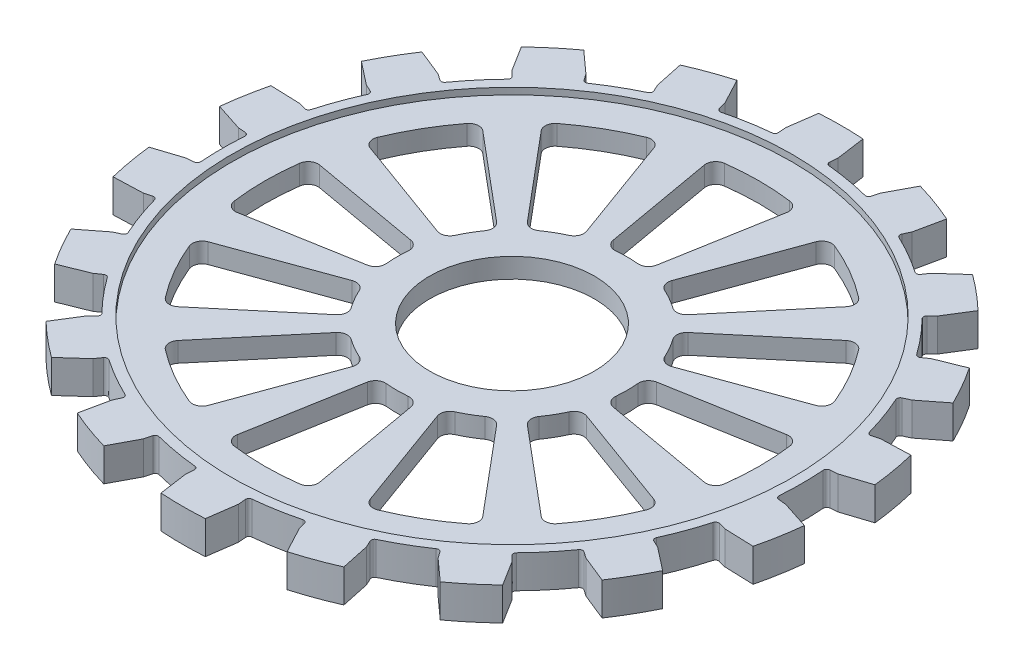
from build123d import *

# Parameters (mm, degrees)
SKETCH_2_W                       = 25
SKETCH_2_H                       = 6
SKETCH_3_W                       = 40
SKETCH_3_H                       = 6
CUT_REVOLVE_2_ANGLE              = 20
FILLET_1_R                       = 3
PATTERN_CIRCULAR_1_COUNT         = 12
FILLET_1_OF_PATTERN_CIRCULAR_1_R = 3
SKETCH_4_W                       = 12
SKETCH_4_H                       = 10
CUT_REVOLVE_3_ANGLE              = 10
FILLET_2_R                       = 1
CHAMFER_1_SIZE                   = 8.662951749
CHAMFER_2_SIZE                   = 8.662951749
PATTERN_START                    = -5
PATTERN_CIRCULAR_2_DEPTH         = 10


with BuildPart() as part:
    # Эскиз1 → Повернуть1 (revolve)
    with BuildSketch(Plane.XY, mode=Mode.PRIVATE) as revolve_1_sk:
        Polygon((0, 3), (85, 3), (85, 5), (100, 5), (100, -5), (85, -5), (85, -3), (0, -3), align=None)
    revolve(revolve_1_sk.sketch.rotate(Axis((0, 0, 0), (0, 1, 0)), 90), axis=Axis((0, 0, 0), (0, 1, 0)))

    # Эскиз2 → Вырез-Повернуть1 (revolve, cut)
    with BuildSketch(Plane.XY, mode=Mode.PRIVATE) as cut_revolve_1_sk:
        with Locations((12.5, 0)):
            Rectangle(SKETCH_2_W, SKETCH_2_H)
    revolve(cut_revolve_1_sk.sketch.rotate(Axis((0, 0, 0), (0, 1, 0)), 90), axis=Axis((0, 0, 0), (0, 1, 0)), mode=Mode.SUBTRACT)

    # Эскиз3 → Вырез-Повернуть2 (revolve, symmetric, cut)
    with BuildSketch(Plane.XY) as cut_revolve_2_sk:
        with Locations((55, 0)):
            Rectangle(SKETCH_3_W, SKETCH_3_H)
    cut_revolve_2 = revolve(axis=Axis((0, 0, 0), (0, 1, 0)), revolution_arc=CUT_REVOLVE_2_ANGLE / 2, mode=Mode.SUBTRACT)
    cut_revolve_2 = cut_revolve_2 + revolve(cut_revolve_2_sk.sketch, axis=Axis((0, 0, 0), (0, -1, 0)), revolution_arc=CUT_REVOLVE_2_ANGLE / 2, mode=Mode.SUBTRACT)

    # Скругление1
    fillet_1_edges = [part.edges().sort_by_distance(p)[0] for p in [
        (34.468271355, 0, -6.077686218),
        (73.860581476, 0, -13.023613325),
        (34.468271355, 0, 6.077686218),
        (73.860581476, 0, 13.023613325),
    ]]
    fillet(fillet_1_edges, radius=FILLET_1_R)

    # Круговой массив1: Вырез-Повернуть2 ×12 about axis
    pattern_circular_1_axis = Axis((0, 0, 0), (0, 1, 0))
    for i in range(1, PATTERN_CIRCULAR_1_COUNT):
        add(cut_revolve_2.rotate(pattern_circular_1_axis, i * 360 / PATTERN_CIRCULAR_1_COUNT), mode=Mode.SUBTRACT)

    # Скругление1 of Круговой массив1
    fillet_1_of_pattern_circular_1_edges = [part.edges().sort_by_distance(p)[0] for p in [
        (26.811555509, 0, -22.497566339),
        (57.453333234, 0, -48.209070726),
        (32.889241728, 0, -11.970705016),
        (70.476946559, 0, -25.651510749),
        (11.970705016, 0, -32.889241728),
        (25.651510749, 0, -70.476946559),
        (22.497566339, 0, -26.811555509),
        (48.209070726, 0, -57.453333234),
        (-6.077686218, 0, -34.468271355),
        (-13.023613325, 0, -73.860581476),
        (6.077686218, 0, -34.468271355),
        (13.023613325, 0, -73.860581476),
        (-22.497566339, 0, -26.811555509),
        (-48.209070726, 0, -57.453333234),
        (-11.970705016, 0, -32.889241728),
        (-25.651510749, 0, -70.476946559),
        (-32.889241728, 0, -11.970705016),
        (-70.476946559, 0, -25.651510749),
        (-26.811555509, 0, -22.497566339),
        (-57.453333234, 0, -48.209070726),
        (-34.468271355, 0, 6.077686218),
        (-73.860581476, 0, 13.023613325),
        (-34.468271355, 0, -6.077686218),
        (-73.860581476, 0, -13.023613325),
        (-26.811555509, 0, 22.497566339),
        (-57.453333234, 0, 48.209070726),
        (-32.889241728, 0, 11.970705016),
        (-70.476946559, 0, 25.651510749),
        (-11.970705016, 0, 32.889241728),
        (-25.651510749, 0, 70.476946559),
        (-22.497566339, 0, 26.811555509),
        (-48.209070726, 0, 57.453333234),
        (6.077686218, 0, 34.468271355),
        (13.023613325, 0, 73.860581476),
        (-6.077686218, 0, 34.468271355),
        (-13.023613325, 0, 73.860581476),
        (22.497566339, 0, 26.811555509),
        (48.209070726, 0, 57.453333234),
        (11.970705016, 0, 32.889241728),
        (25.651510749, 0, 70.476946559),
        (32.889241728, 0, 11.970705016),
        (70.476946559, 0, 25.651510749),
        (26.811555509, 0, 22.497566339),
        (57.453333234, 0, 48.209070726),
    ]]
    fillet(fillet_1_of_pattern_circular_1_edges, radius=FILLET_1_OF_PATTERN_CIRCULAR_1_R)

    # Эскиз4 → Вырез-Повернуть3 (revolve, symmetric, cut)
    with BuildSketch(Plane.XY) as cut_revolve_3_sk:
        with Locations((94, 0)):
            Rectangle(SKETCH_4_W, SKETCH_4_H)
    revolve(axis=Axis((0, 0, 0), (0, 1, 0)), revolution_arc=CUT_REVOLVE_3_ANGLE / 2, mode=Mode.SUBTRACT)
    revolve(cut_revolve_3_sk.sketch, axis=Axis((0, 0, 0), (0, -1, 0)), revolution_arc=CUT_REVOLVE_3_ANGLE / 2, mode=Mode.SUBTRACT)

    # Скругление2
    fillet_2_edges = [part.edges().sort_by_distance(p)[0] for p in [
        (87.665133432, 0, -7.669705362),
        (87.665133432, 0, 7.669705362),
    ]]
    fillet(fillet_2_edges, radius=FILLET_2_R)

    # Фаска1
    # the kernel refuses this chamfer: 8.662951749, 2 mm, written as the material it takes off along each edge
    with BuildSketch(Plane(origin=(99.619469809, 27.502315295, -8.715574275), x_dir=(-0.09709095051673582, 0, -0.995275513276478), z_dir=(0, -1, 0))) as chamfer_1_piece_1:
        with BuildLine():
            Line((1.995502708, 0), (CHAMFER_1_SIZE * 0.0099775135388, -CHAMFER_1_SIZE * 0.999950223323))
            Line((CHAMFER_1_SIZE * 0.0099775135388, -CHAMFER_1_SIZE * 0.999950223323), (0, 0))
            ThreePointArc((0, 0), (1.034978691, 0.004970733), (1.995502708, 0))
        make_face()
    extrude(amount=55.004630589, mode=Mode.SUBTRACT)

    # Фаска2
    # the kernel refuses this chamfer: 8.662951749, 2 mm, written as the material it takes off along each edge
    with BuildSketch(Plane(origin=(99.619469809, 27.502315295, 8.715574275), x_dir=(-0.9961946980917455, 0, -0.08715574274765818), z_dir=(0, -1, 0))) as chamfer_2_piece_1:
        with BuildLine():
            Line((CHAMFER_2_SIZE, 0), (0.019910155, -1.995403378))
            ThreePointArc((0.019910155, -1.995403378), (0.005356028, -1.034976768), (0, 0))
            Line((0, 0), (CHAMFER_2_SIZE, 0))
        make_face()
    extrude(amount=55.004630589, mode=Mode.SUBTRACT)

    # Круговой массив2: read off the stored shape, not the designer's step
    # Круговой массив2 outline → Круговой массив2 (cut)
    with BuildSketch(Plane(origin=(0, 0, 0), x_dir=(1, 0, 0), z_dir=(0, 1, 0)).offset(PATTERN_START)):
        with BuildLine():
            ThreePointArc((85.961971819, -23.033440929), (85.208026052, -23.130545985), (84.740196001, -23.729710949))
            ThreePointArc((84.740196001, -23.729710949), (82.692950629, -30.097772613), (80.167920435, -36.291934823))
            ThreePointArc((80.167920435, -36.291934823), (80.141163231, -37.051637174), (80.656301269, -37.61065096))
            Line((80.656301269, -37.61065096), (82.779478075, -38.600704565))
            Line((82.779478075, -38.600704565), (89.769440068, -44.061861399))
            ThreePointArc((89.769440068, -44.061861399), (93.969262079, -34.202014333), (97.089799293, -23.949339726))
            Line((97.089799293, -23.949339726), (88.224813803, -23.639767611))
            Line((88.224813803, -23.639767611), (85.961971819, -23.033440929))
        make_face()
        with BuildLine():
            ThreePointArc((97.089799293, 23.949339726), (93.969262079, 34.202014333), (89.769440068, 44.061861399))
            Line((89.769440068, 44.061861399), (82.779478075, 38.600704565))
            Line((82.779478075, 38.600704565), (80.656301269, 37.61065096))
            ThreePointArc((80.656301269, 37.61065096), (80.141163231, 37.051637174), (80.167920435, 36.291934823))
            ThreePointArc((80.167920435, 36.291934823), (82.692950629, 30.097772613), (84.740196001, 23.729710949))
            ThreePointArc((84.740196001, 23.729710949), (85.208026052, 23.130545985), (85.961971819, 23.033440929))
            Line((85.961971819, 23.033440929), (88.224813803, 23.639767611))
            Line((88.224813803, 23.639767611), (97.089799293, 23.949339726))
        make_face()
        with BuildLine():
            ThreePointArc((83.043411343, 55.711684883), (76.604444312, 64.278760969), (69.285636253, 72.107562773))
            Line((69.285636253, 72.107562773), (64.585046192, 64.585046192))
            Line((64.585046192, 64.585046192), (62.92853089, 62.92853089))
            ThreePointArc((62.92853089, 62.92853089), (62.635653453, 62.227042175), (62.920630507, 61.522306984))
            ThreePointArc((62.920630507, 61.522306984), (67.411910994, 56.565309652), (71.513697726, 51.281488254))
            ThreePointArc((71.513697726, 51.281488254), (72.15824066, 50.87846466), (72.899929819, 51.045080394))
            Line((72.899929819, 51.045080394), (74.818929794, 52.388778643))
            Line((74.818929794, 52.388778643), (83.043411343, 55.711684883))
        make_face()
        with BuildLine():
            ThreePointArc((58.980762396, 80.754378626), (50, 86.602540379), (40.444962159, 91.456027882))
            Line((40.444962159, 91.456027882), (38.600704565, 82.779478075))
            Line((38.600704565, 82.779478075), (37.61065096, 80.656301269))
            ThreePointArc((37.61065096, 80.656301269), (37.575359464, 79.896947517), (38.08418393, 79.332180951))
            ThreePointArc((38.08418393, 79.332180951), (44, 76.210235533), (49.661592076, 72.647961241))
            ThreePointArc((49.661592076, 72.647961241), (50.405106502, 72.489689611), (51.045080394, 72.899929819))
            Line((51.045080394, 72.899929819), (52.388778643, 74.818929794))
            Line((52.388778643, 74.818929794), (58.980762396, 80.754378626))
        make_face()
        with BuildLine():
            ThreePointArc((27.80416304, 96.056902499), (17.364817767, 98.480775302), (6.726028724, 99.773546282))
            Line((6.726028724, 99.773546282), (7.960548281, 90.989483207))
            Line((7.960548281, 90.989483207), (7.75637145, 88.655731354))
            ThreePointArc((7.75637145, 88.655731354), (7.982922571, 87.930101834), (8.654222708, 87.573423076))
            ThreePointArc((8.654222708, 87.573423076), (15.281039634, 86.663082265), (21.819565494, 85.252017933))
            ThreePointArc((21.819565494, 85.252017933), (22.5723726, 85.35758816), (23.033440929, 85.961971819))
            Line((23.033440929, 85.961971819), (23.639767611, 88.224813803))
            Line((23.639767611, 88.224813803), (27.80416304, 96.056902499))
        make_face()
        with BuildLine():
            ThreePointArc((-6.726028724, 99.773546282), (-17.364817767, 98.480775301), (-27.80416304, 96.056902499))
            Line((-27.80416304, 96.056902499), (-23.639767611, 88.224813803))
            Line((-23.639767611, 88.224813803), (-23.033440929, 85.961971819))
            ThreePointArc((-23.033440929, 85.961971819), (-22.5723726, 85.35758816), (-21.819565494, 85.252017933))
            ThreePointArc((-21.819565494, 85.252017933), (-15.281039634, 86.663082265), (-8.654222708, 87.573423076))
            ThreePointArc((-8.654222708, 87.573423076), (-7.982922571, 87.930101834), (-7.75637145, 88.655731354))
            Line((-7.75637145, 88.655731354), (-7.960548281, 90.989483207))
            Line((-7.960548281, 90.989483207), (-6.726028724, 99.773546282))
        make_face()
        with BuildLine():
            ThreePointArc((-40.444962159, 91.456027882), (-50, 86.602540378), (-58.980762396, 80.754378626))
            Line((-58.980762396, 80.754378626), (-52.388778643, 74.818929794))
            Line((-52.388778643, 74.818929794), (-51.045080394, 72.899929819))
            ThreePointArc((-51.045080394, 72.899929819), (-50.405106502, 72.489689611), (-49.661592076, 72.647961241))
            ThreePointArc((-49.661592076, 72.647961241), (-44, 76.210235533), (-38.08418393, 79.332180951))
            ThreePointArc((-38.08418393, 79.332180951), (-37.575359464, 79.896947517), (-37.61065096, 80.656301269))
            Line((-37.61065096, 80.656301269), (-38.600704565, 82.779478075))
            Line((-38.600704565, 82.779478075), (-40.444962159, 91.456027882))
        make_face()
        with BuildLine():
            ThreePointArc((-69.285636253, 72.107562773), (-76.604444312, 64.278760969), (-83.043411343, 55.711684883))
            Line((-83.043411343, 55.711684883), (-74.818929794, 52.388778643))
            Line((-74.818929794, 52.388778643), (-72.899929819, 51.045080394))
            ThreePointArc((-72.899929819, 51.045080394), (-72.15824066, 50.87846466), (-71.513697726, 51.281488254))
            ThreePointArc((-71.513697726, 51.281488254), (-67.411910994, 56.565309652), (-62.920630507, 61.522306984))
            ThreePointArc((-62.920630507, 61.522306984), (-62.635653453, 62.227042175), (-62.92853089, 62.92853089))
            Line((-62.92853089, 62.92853089), (-64.585046192, 64.585046192))
            Line((-64.585046192, 64.585046192), (-69.285636253, 72.107562773))
        make_face()
        with BuildLine():
            ThreePointArc((-89.769440068, 44.061861399), (-93.969262079, 34.202014333), (-97.089799293, 23.949339726))
            Line((-97.089799293, 23.949339726), (-88.224813803, 23.639767611))
            Line((-88.224813803, 23.639767611), (-85.961971819, 23.033440929))
            ThreePointArc((-85.961971819, 23.033440929), (-85.208026052, 23.130545985), (-84.740196001, 23.729710949))
            ThreePointArc((-84.740196001, 23.729710949), (-82.692950629, 30.097772613), (-80.167920435, 36.291934823))
            ThreePointArc((-80.167920435, 36.291934823), (-80.141163231, 37.051637174), (-80.656301269, 37.61065096))
            Line((-80.656301269, 37.61065096), (-82.779478075, 38.600704565))
            Line((-82.779478075, 38.600704565), (-89.769440068, 44.061861399))
        make_face()
        with BuildLine():
            ThreePointArc((-99.425724554, 10.701649257), (-100, 0), (-99.425724554, -10.701649257))
            Line((-99.425724554, -10.701649257), (-90.989483207, -7.960548281))
            Line((-90.989483207, -7.960548281), (-88.655731354, -7.75637145))
            ThreePointArc((-88.655731354, -7.75637145), (-87.980465966, -7.407257906), (-87.745776006, -6.68421971))
            ThreePointArc((-87.745776006, -6.68421971), (-88, 0), (-87.745776006, 6.68421971))
            ThreePointArc((-87.745776006, 6.68421971), (-87.980465966, 7.407257906), (-88.655731354, 7.75637145))
            Line((-88.655731354, 7.75637145), (-90.989483207, 7.960548281))
            Line((-90.989483207, 7.960548281), (-99.425724554, 10.701649257))
        make_face()
        with BuildLine():
            ThreePointArc((-97.089799293, -23.949339726), (-93.969262079, -34.202014333), (-89.769440068, -44.061861399))
            Line((-89.769440068, -44.061861399), (-82.779478075, -38.600704565))
            Line((-82.779478075, -38.600704565), (-80.656301269, -37.61065096))
            ThreePointArc((-80.656301269, -37.61065096), (-80.141163231, -37.051637174), (-80.167920435, -36.291934823))
            ThreePointArc((-80.167920435, -36.291934823), (-82.692950629, -30.097772613), (-84.740196001, -23.729710949))
            ThreePointArc((-84.740196001, -23.729710949), (-85.208026052, -23.130545985), (-85.961971819, -23.033440929))
            Line((-85.961971819, -23.033440929), (-88.224813803, -23.639767611))
            Line((-88.224813803, -23.639767611), (-97.089799293, -23.949339726))
        make_face()
        with BuildLine():
            ThreePointArc((-83.043411343, -55.711684883), (-76.604444312, -64.278760969), (-69.285636253, -72.107562773))
            Line((-69.285636253, -72.107562773), (-64.585046192, -64.585046192))
            Line((-64.585046192, -64.585046192), (-62.92853089, -62.92853089))
            ThreePointArc((-62.92853089, -62.92853089), (-62.635653453, -62.227042175), (-62.920630507, -61.522306984))
            ThreePointArc((-62.920630507, -61.522306984), (-67.411910994, -56.565309652), (-71.513697726, -51.281488254))
            ThreePointArc((-71.513697726, -51.281488254), (-72.15824066, -50.87846466), (-72.899929819, -51.045080394))
            Line((-72.899929819, -51.045080394), (-74.818929794, -52.388778643))
            Line((-74.818929794, -52.388778643), (-83.043411343, -55.711684883))
        make_face()
        with BuildLine():
            ThreePointArc((-58.980762396, -80.754378626), (-50, -86.602540378), (-40.444962159, -91.456027882))
            Line((-40.444962159, -91.456027882), (-38.600704565, -82.779478075))
            Line((-38.600704565, -82.779478075), (-37.61065096, -80.656301269))
            ThreePointArc((-37.61065096, -80.656301269), (-37.575359464, -79.896947517), (-38.08418393, -79.332180951))
            ThreePointArc((-38.08418393, -79.332180951), (-44, -76.210235533), (-49.661592076, -72.647961241))
            ThreePointArc((-49.661592076, -72.647961241), (-50.405106502, -72.489689611), (-51.045080394, -72.899929819))
            Line((-51.045080394, -72.899929819), (-52.388778643, -74.818929794))
            Line((-52.388778643, -74.818929794), (-58.980762396, -80.754378626))
        make_face()
        with BuildLine():
            ThreePointArc((-27.80416304, -96.056902499), (-17.364817767, -98.480775301), (-6.726028724, -99.773546282))
            Line((-6.726028724, -99.773546282), (-7.960548281, -90.989483207))
            Line((-7.960548281, -90.989483207), (-7.75637145, -88.655731354))
            ThreePointArc((-7.75637145, -88.655731354), (-7.982922571, -87.930101834), (-8.654222708, -87.573423076))
            ThreePointArc((-8.654222708, -87.573423076), (-15.281039634, -86.663082265), (-21.819565494, -85.252017933))
            ThreePointArc((-21.819565494, -85.252017933), (-22.5723726, -85.35758816), (-23.033440929, -85.961971819))
            Line((-23.033440929, -85.961971819), (-23.639767611, -88.224813803))
            Line((-23.639767611, -88.224813803), (-27.80416304, -96.056902499))
        make_face()
        with BuildLine():
            ThreePointArc((6.726028724, -99.773546282), (17.364817767, -98.480775302), (27.80416304, -96.056902499))
            Line((27.80416304, -96.056902499), (23.639767611, -88.224813803))
            Line((23.639767611, -88.224813803), (23.033440929, -85.961971819))
            ThreePointArc((23.033440929, -85.961971819), (22.5723726, -85.35758816), (21.819565494, -85.252017933))
            ThreePointArc((21.819565494, -85.252017933), (15.281039634, -86.663082265), (8.654222708, -87.573423076))
            ThreePointArc((8.654222708, -87.573423076), (7.982922571, -87.930101834), (7.75637145, -88.655731354))
            Line((7.75637145, -88.655731354), (7.960548281, -90.989483207))
            Line((7.960548281, -90.989483207), (6.726028724, -99.773546282))
        make_face()
        with BuildLine():
            ThreePointArc((40.444962159, -91.456027882), (50, -86.602540379), (58.980762396, -80.754378626))
            Line((58.980762396, -80.754378626), (52.388778643, -74.818929794))
            Line((52.388778643, -74.818929794), (51.045080394, -72.899929819))
            ThreePointArc((51.045080394, -72.899929819), (50.405106502, -72.489689611), (49.661592076, -72.647961241))
            ThreePointArc((49.661592076, -72.647961241), (44, -76.210235533), (38.08418393, -79.332180951))
            ThreePointArc((38.08418393, -79.332180951), (37.575359464, -79.896947517), (37.61065096, -80.656301269))
            Line((37.61065096, -80.656301269), (38.600704565, -82.779478075))
            Line((38.600704565, -82.779478075), (40.444962159, -91.456027882))
        make_face()
        with BuildLine():
            ThreePointArc((69.285636253, -72.107562773), (76.604444312, -64.278760969), (83.043411343, -55.711684883))
            Line((83.043411343, -55.711684883), (74.818929794, -52.388778643))
            Line((74.818929794, -52.388778643), (72.899929819, -51.045080394))
            ThreePointArc((72.899929819, -51.045080394), (72.15824066, -50.87846466), (71.513697726, -51.281488254))
            ThreePointArc((71.513697726, -51.281488254), (67.411910994, -56.565309652), (62.920630507, -61.522306984))
            ThreePointArc((62.920630507, -61.522306984), (62.635653453, -62.227042175), (62.92853089, -62.92853089))
            Line((62.92853089, -62.92853089), (64.585046192, -64.585046192))
            Line((64.585046192, -64.585046192), (69.285636253, -72.107562773))
        make_face()
    extrude(amount=PATTERN_CIRCULAR_2_DEPTH, mode=Mode.SUBTRACT)


solid = part.part
